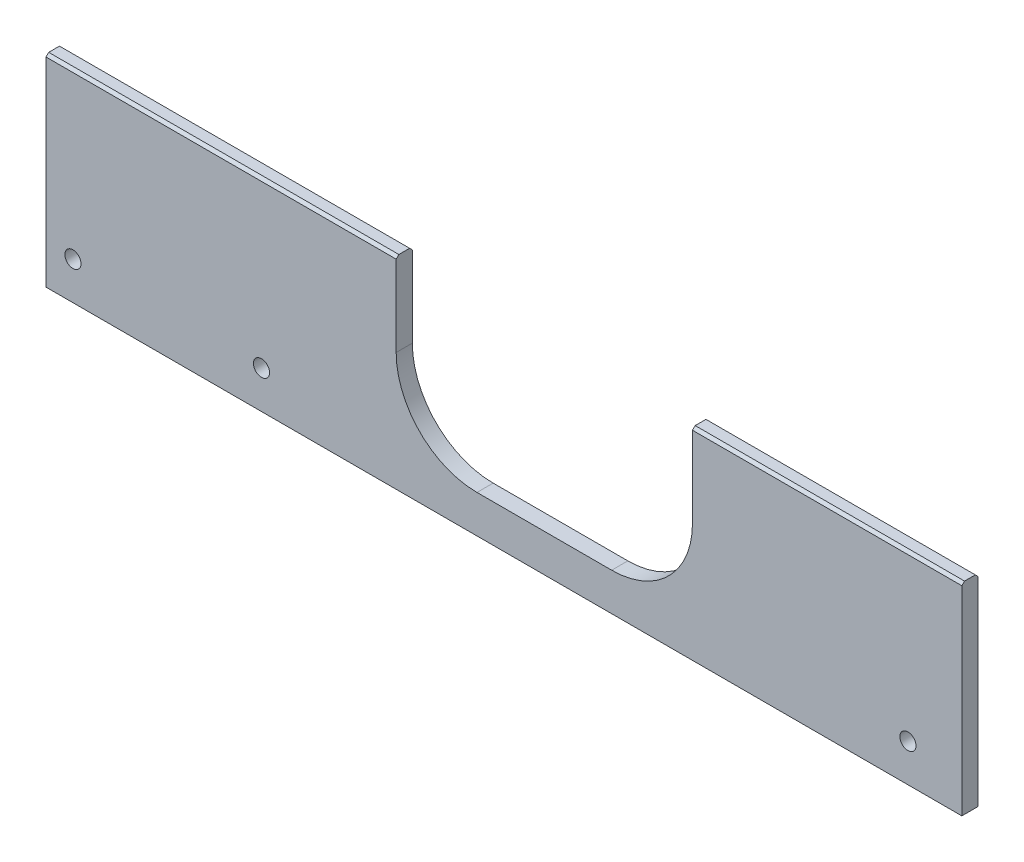
from build123d import *

# Parameters (mm, degrees)
SKETCH_1_W          = 170
SKETCH_1_H          = 37.5
EXTRUDE_1_DEPTH     = 3
SKETCH_2_R          = 1.5
CUT_EXTRUDE_1_DEPTH = 3
CUT_EXTRUDE_2_DEPTH = 3
SKETCH_4_R          = 1.5
CUT_EXTRUDE_3_DEPTH = 3
CHAMFER_1_SIZE      = 0.5


with BuildPart() as part:
    # 草图1 → 凸台-拉伸1 (new body)
    with BuildSketch(Plane.XY):
        with Locations((-15, -3.75)):
            Rectangle(SKETCH_1_W, SKETCH_1_H)
    extrude(amount=EXTRUDE_1_DEPTH)

    # 草图2 → 切除-拉伸1 (cut)
    with BuildSketch(Plane.XY.offset(3)):
        with Locations((60, -15.5)):
            Circle(SKETCH_2_R)
        with Locations((-60, -15.5)):
            Circle(SKETCH_2_R)
    extrude(amount=-CUT_EXTRUDE_1_DEPTH, mode=Mode.SUBTRACT)

    # 草图3 → 切除-拉伸2 (cut)
    with BuildSketch(Plane.XY.offset(3)):
        with BuildLine():
            Line((-20, -15.5), (5, -15.5))
            ThreePointArc((5, -15.5), (15.606601718, -11.106601718), (20, -0.5))
            Line((20, -0.5), (20, 15))
            Line((20, 15), (-35, 15))
            Line((-35, 15), (-35, -0.5))
            ThreePointArc((-35, -0.5), (-30.606601718, -11.106601718), (-20, -15.5))
        make_face()
    extrude(amount=-CUT_EXTRUDE_2_DEPTH, mode=Mode.SUBTRACT)

    # 草图4 → 切除-拉伸3 (cut)
    with BuildSketch(Plane.XY.offset(3)):
        with Locations((-95, -15.5)):
            Circle(SKETCH_4_R)
    extrude(amount=-CUT_EXTRUDE_3_DEPTH, mode=Mode.SUBTRACT)

    # 倒角1
    chamfer_1_edges = [part.edges().sort_by_distance(p)[0] for p in [
        (45, 15, 0),
        (-67.5, 15, 0),
        (45, 15, 3),
        (-67.5, 15, 3),
    ]]
    chamfer(chamfer_1_edges, length=CHAMFER_1_SIZE)


solid = part.part
